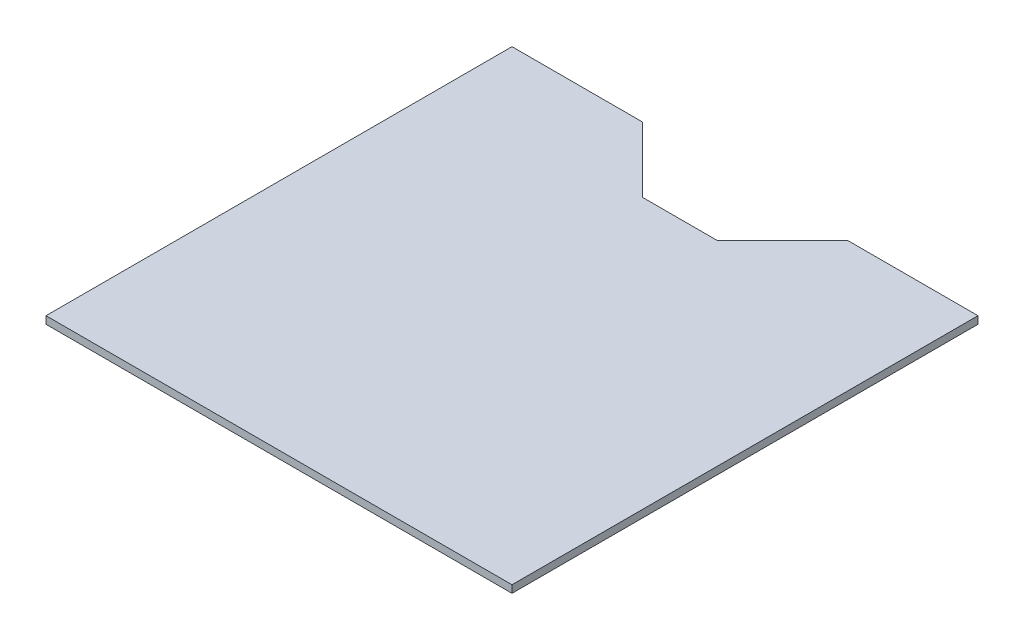
from build123d import *

# Parameters (mm, degrees)
SKETCH_1_W               = 500
SKETCH_1_H               = 500
EXTRUDE_1_DEPTH          = 4
CUT_EXTRUDE_1_DEPTH      = 354.643888679
CUT_EXTRUDE_1_DEPTH_BACK = 354.643888679


with BuildPart() as part:
    # 草图1 → 凸台-拉伸1 (new, symmetric)
    with BuildSketch(Plane(origin=(0, 0, 0), x_dir=(1, 0, 0), z_dir=(0, 1, 0))):
        Rectangle(SKETCH_1_W, SKETCH_1_H)
    extrude(amount=EXTRUDE_1_DEPTH, both=True)

    # 草图3 → 切除-拉伸1 (cut, two sides: drawn at the far end of the back side and taken through both)
    with BuildSketch(Plane(origin=(0, 4, 0), x_dir=(1, 0, 0), z_dir=(0, 1, 0)).offset(-CUT_EXTRUDE_1_DEPTH_BACK)):
        Polygon((988.391904244, 1128.391904244), (110, 250), (40, 180), (-40, 180), (-110, 250), (-988.391904244, 1128.391904244), (-988.391904244, 3612.859392363), (988.391904244, 3612.859392363), align=None)
    extrude(amount=CUT_EXTRUDE_1_DEPTH + CUT_EXTRUDE_1_DEPTH_BACK, mode=Mode.SUBTRACT)


solid = part.part
